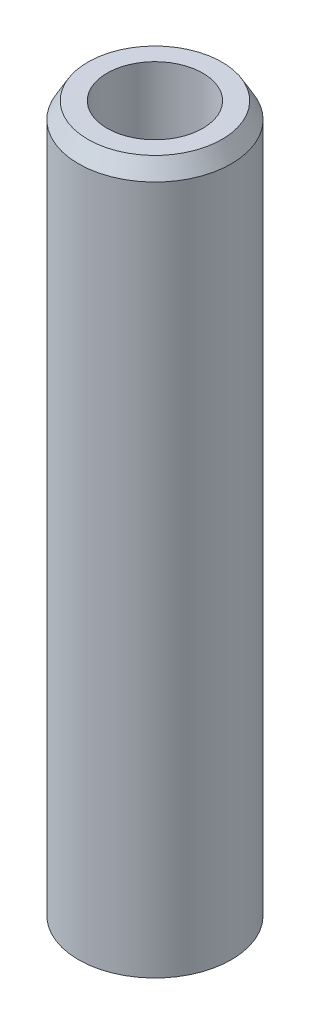
from build123d import *
from OCP.BRepFilletAPI import BRepFilletAPI_MakeChamfer

# Parameters (mm, degrees)
SKETCH1_R           = 7.5
BOSS_EXTRUDE1_DEPTH = 70.126757337
SKETCH2_R           = 4.692175939
CUT_EXTRUDE1_DEPTH  = 71.924340635
CHAMFER1_SIZE       = 1.607668004
CHAMFER1_SIZE2      = 0.928187555


with BuildPart() as part:
    # Sketch1 → Boss-Extrude1 (new body)
    with BuildSketch(Plane(origin=(0, 0, 0), x_dir=(1, 0, 0), z_dir=(0, 1, 0))):
        Circle(SKETCH1_R)
    extrude(amount=BOSS_EXTRUDE1_DEPTH)

    # Sketch2 → Cut-Extrude1 (cut, through all)
    with BuildSketch(Plane(origin=(0, 0, 0), x_dir=(1, 0, 0), z_dir=(0, 1, 0))):
        Circle(SKETCH2_R)
    extrude(amount=CUT_EXTRUDE1_DEPTH, mode=Mode.SUBTRACT)

    # Chamfer1: one chamfer whose edges measure the first distance from different faces: ONE call of the kernel's chamfer builder (chamfer() names one face for all edges)
    chamfer1_edges_1 = [part.edges().sort_by_distance(p)[0] for p in [
        (-7.5, 70.126757337, 0),
    ]]
    chamfer1_side_1 = [part.faces().sort_by_distance(p)[0] for p in [
        (-7.5, 35.063378668, 0),
    ]]
    chamfer1_edges_2 = [part.edges().sort_by_distance(p)[0] for p in [
        (-7.5, 0, 0),
    ]]
    chamfer1_side_2 = [part.faces().sort_by_distance(p)[0] for p in [
        (-7.287867966, 0, 0),
    ]]
    chamfer1 = BRepFilletAPI_MakeChamfer(part.part.solid().wrapped)
    for e in chamfer1_edges_1:
        chamfer1.Add(CHAMFER1_SIZE, CHAMFER1_SIZE2, e.wrapped, chamfer1_side_1[0].wrapped)  # the first distance lies on this face
    for e in chamfer1_edges_2:
        chamfer1.Add(CHAMFER1_SIZE, CHAMFER1_SIZE2, e.wrapped, chamfer1_side_2[0].wrapped)  # the first distance lies on this face
    add(Compound.cast(chamfer1.Shape()), mode=Mode.REPLACE)


solid = part.part
